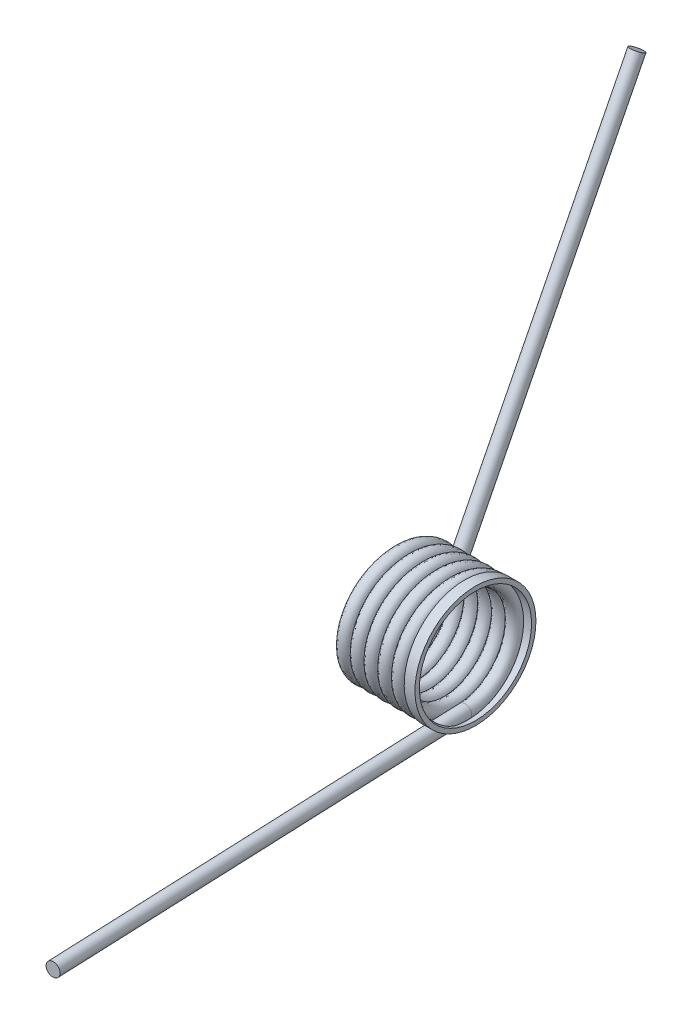
from build123d import *

# Parameters (mm, degrees)
SWEEP1_PITCH        = 1.6256
SKETCH4_R           = 0.8001
EXTRUDE1_DEPTH      = 50.8
SKETCH5_R           = 0.8001
EXTRUDE2_DEPTH      = 50.8
SKETCH8_R           = 7.153499718
SKETCH8_R_2         = 6.632167036
BOSS_EXTRUDE1_DEPTH = 1.27


with BuildPart() as part:
    # Sweep1: the profile of Sketch3 screwed along a left-hand helix of 5.166667 turns, 6 arcs to a turn; built about Z, then put on its axis
    sweep1_z = Axis((0, 0, 0), (0, 0, 1))
    sweep1_corners = [(6.330491227, -0.032759418, -0.799212861), (7.111783977, 0.000761408, 0.018575629), (6.293308773, 0.032759418, 0.799212861), (5.512016023, -0.000761408, -0.018575629)]
    with BuildLine(mode=Mode.PRIVATE) as sweep1_profile:
        ThreePointArc((6.330491227, -0.032759418, -0.799212861), (6.890649367, -0.02262601, -0.551993881), (7.111783977, 0.000761408, 0.018575629))
        ThreePointArc((7.111783977, 0.000761408, 0.018575629), (6.864357402, 0.023702803, 0.578263786), (6.293308773, 0.032759418, 0.799212861))
        ThreePointArc((6.293308773, 0.032759418, 0.799212861), (5.733150633, 0.02262601, 0.551993881), (5.512016023, -0.000761408, -0.018575629))
        ThreePointArc((5.512016023, -0.000761408, -0.018575629), (5.759442598, -0.023702803, -0.578263786), (6.330491227, -0.032759418, -0.799212861))
    sweep1_cap = Face(sweep1_profile.wire())
    sweep1_arcs = [((6.330491227, -0.032759418, -0.799212861), (7.130375204, -0.03199801, -0.780637232), (7.111783977, 0.000761408, 0.018575629), (1, 0.7071067811865476, 1)), ((7.111783977, 0.000761408, 0.018575629), (7.09319275, 0.033520826, 0.817788489), (6.293308773, 0.032759418, 0.799212861), (1, 0.7071067811865476, 1)), ((6.293308773, 0.032759418, 0.799212861), (5.493424796, 0.03199801, 0.780637232), (5.512016023, -0.000761408, -0.018575629), (1, 0.7071067811865476, 1)), ((5.512016023, -0.000761408, -0.018575629), (5.53060725, -0.033520826, -0.817788489), (6.330491227, -0.032759418, -0.799212861), (1, 0.7071067811865476, 1))]  # start, shoulder, end, weights
    sweep1_turn_angles = [0, -30, -60, -90, -120, -150, -180, -210, -240, -270, -300, -330, -360]
    sweep1_turn_weights = [1, 0.8660254037844387, 1, 0.8660254037844387, 1, 0.8660254037844387, 1, 0.8660254037844387, 1, 0.8660254037844387, 1, 0.8660254037844387, 1]
    sweep1_turn_sides = [Face.make_bezier_surface([[Vector(p[j][0], p[j][1], 0).rotate(sweep1_z, sweep1_turn_angles[2 * i + k]) / sweep1_turn_weights[2 * i + k] + Vector(0, 0, p[j][2] + -SWEEP1_PITCH * sweep1_turn_angles[2 * i + k] / 360) for k in range(3)] for j in range(3)], [[p[3][j] * sweep1_turn_weights[2 * i + k] for k in range(3)] for j in range(3)]) for p in sweep1_arcs for i in range(6)]
    sweep1_last_angles = [-1800, -1830, -1860]
    sweep1_last_weights = [1, 0.8660254037844158, 1]
    sweep1_last_sides = [Face.make_bezier_surface([[Vector(p[j][0], p[j][1], 0).rotate(sweep1_z, sweep1_last_angles[2 * i + k]) / sweep1_last_weights[2 * i + k] + Vector(0, 0, p[j][2] + -SWEEP1_PITCH * sweep1_last_angles[2 * i + k] / 360) for k in range(3)] for j in range(3)], [[p[3][j] * sweep1_last_weights[2 * i + k] for k in range(3)] for j in range(3)]) for p in sweep1_arcs for i in range(1)]
    sweep1 = Plane(origin=(0, 0, 0), x_dir=(0, -1, 0), z_dir=(-1, 0, 0)) * Solid(Shell([*[p.moved(Location((0, 0, SWEEP1_PITCH * i))) for i in range(5) for p in sweep1_turn_sides], *sweep1_last_sides, sweep1_cap, sweep1_cap.rotate(sweep1_z, -1860).moved(Location((0, 0, -SWEEP1_PITCH * -1860 / 360)))]))
    add(sweep1)

    # Sketch4 → Extrude1 (add)
    with BuildSketch(Plane(origin=(0, 0, 0), x_dir=(-0.9988912145610835, 0.02323612909274781, 0.040944154374815696), z_dir=(0.04095521208944008, -1.1519539662441236e-14, 0.9991609833268658))):
        with Locations(Location((-0.146664123, 6.310195817, 0), (0, 0, 1.33145196))):
            Circle(SKETCH4_R)
    extrude(amount=EXTRUDE1_DEPTH)

    # Sketch5 → Extrude2 (add)
    with BuildSketch(Plane(origin=(-0.014087778, 0.297645562, -0.171845745), x_dir=(0.9991609827879865, 0.035484675571451844, -0.02044916315485051), z_dir=(-0.040955212089440085, 0.8652987940313562, -0.49958049166334506))):
        with Locations(Location((-8.392093785, 6.311624382, 0), (0, 0, 180.001881766))):
            Circle(SKETCH5_R)
    extrude(amount=EXTRUDE2_DEPTH)

    # Sketch8 → Boss-Extrude1 (add)
    with BuildSketch(Plane(origin=(0, 0, 0), x_dir=(0, 0, -1), z_dir=(1, 0, 0))):
        with Locations(Location((0, 0, 0), (0, 0, 230.674391039))):
            Circle(SKETCH8_R)
        with Locations(Location((0, 0, 0), (0, 0, 236.430462639))):
            Circle(SKETCH8_R_2, mode=Mode.SUBTRACT)
    extrude(amount=BOSS_EXTRUDE1_DEPTH)


solid = part.part
